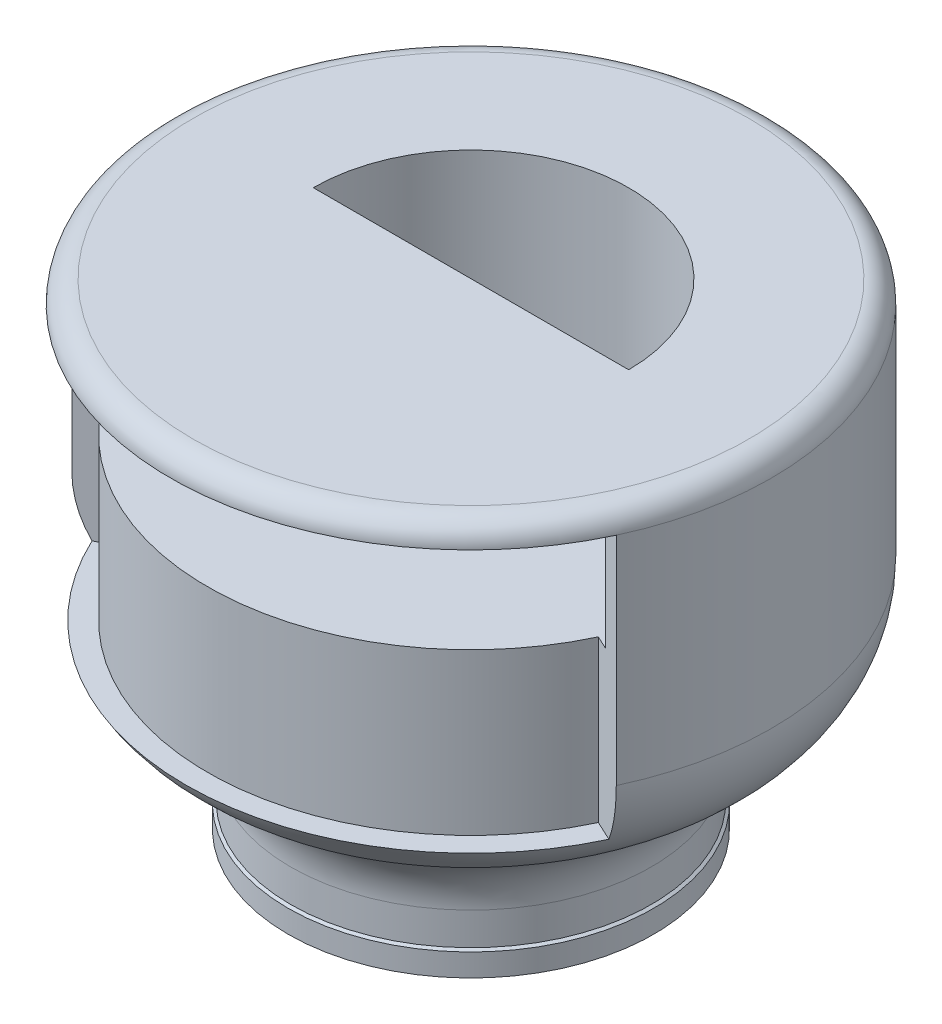
from build123d import *

# Parameters (mm, degrees)
CUT_EXTRUDE3_DEPTH           = 60
CUT_EXTRUDE5_DEPTH           = 2
CUT_EXTRUDE5_DEPTH_BACK      = 15
SKETCH19_W                   = 12
SKETCH19_H                   = 36.411527776
CUT_REVOLVE2_ANGLE           = 65
CUT_REVOLVE2_OTHER_WAY_ANGLE = 65


with BuildPart() as part:
    # Sketch1 → Revolve1 (revolve)
    with BuildSketch(Plane.XY):
        with BuildLine():
            Line((0, 63.427876097), (37, 63.427876097))
            ThreePointArc((37, 63.427876097), (39.121320344, 62.54919644), (40, 60.427876097))
            Line((40, 60.427876097), (40, 31.556288966))
            ThreePointArc((40, 31.556288966), (38.188122658, 24.409721904), (33.190210564, 18.989648567))
            Line((33.190210564, 18.989648567), (28.539859624, 15.958818353))
            ThreePointArc((28.539859624, 15.958818353), (25.207918228, 12.345436129), (24, 7.581058088))
            Line((24, 7.581058088), (24, 3.25))
            Line((24, 3.25), (24.35, 3))
            Line((24.35, 3), (24.35, 0))
            Line((24.35, 0), (22.5, 0))
            Line((22.5, 0), (22.5, 12.5))
            ThreePointArc((22.5, 12.5), (22.353553391, 12.853553391), (22, 13))
            Line((22, 13), (0, 13))
            Line((0, 13), (0, 63.427876097))
        make_face()
    revolve(axis=Axis((0, 0, 0), (0, 1, 0)))

    # Sketch11 → Cut-Extrude3 (cut)
    with BuildSketch(Plane(origin=(0, 13, 0), x_dir=(-1, 0, 0), z_dir=(0, -1, 0))):
        with BuildLine():
            Line((-21, 0), (21, 0))
            ThreePointArc((21, 0), (0, 21), (-21, 0))
        make_face()
    extrude(amount=-CUT_EXTRUDE3_DEPTH, mode=Mode.SUBTRACT)

    # Sketch9 → Cut-Extrude5 (cut, two sides: drawn at the far end of the back side and taken through both)
    with BuildSketch(Plane(origin=(0, 60.427876097, 0), x_dir=(1, 0, 0), z_dir=(0, 1, 0)).offset(-CUT_EXTRUDE5_DEPTH_BACK)):
        with BuildLine():
            ThreePointArc((-37, -1.601545046), (-0.376939953, -37.002145429), (37, -2.398454954))
            ThreePointArc((37, -2.398454954), (0.42119799, 37.111888235), (-37, -1.601545046))
        make_face()
        with BuildLine():
            Line((-22, -1.763080838), (22, -2.236919162))
            ThreePointArc((22, -2.236919162), (0.283876608, 24.360406363), (-22, -1.763080838))
        make_face(mode=Mode.SUBTRACT)
    extrude(amount=CUT_EXTRUDE5_DEPTH + CUT_EXTRUDE5_DEPTH_BACK, mode=Mode.SUBTRACT)

    # Sketch19 → Cut-Revolve2 (revolve, cut)
    with BuildSketch(Plane(origin=(0, 0, 0), x_dir=(0, 0, -1), z_dir=(1, 0, 0))):
        with Locations((-41.064715832, 42.222112209)):
            Rectangle(SKETCH19_W, SKETCH19_H)
    revolve(axis=Axis((0, 0, 0), (0, 1, 0)), revolution_arc=CUT_REVOLVE2_ANGLE, mode=Mode.SUBTRACT)

    # Sketch19 → Cut-Revolve2 other way (revolve, cut)
    with BuildSketch(Plane(origin=(0, 0, 0), x_dir=(0, 0, -1), z_dir=(1, 0, 0))):
        with Locations((-41.064715832, 42.222112209)):
            Rectangle(SKETCH19_W, SKETCH19_H)
    revolve(axis=Axis((0, 0, 0), (0, -1, 0)), revolution_arc=CUT_REVOLVE2_OTHER_WAY_ANGLE, mode=Mode.SUBTRACT)


solid = part.part
